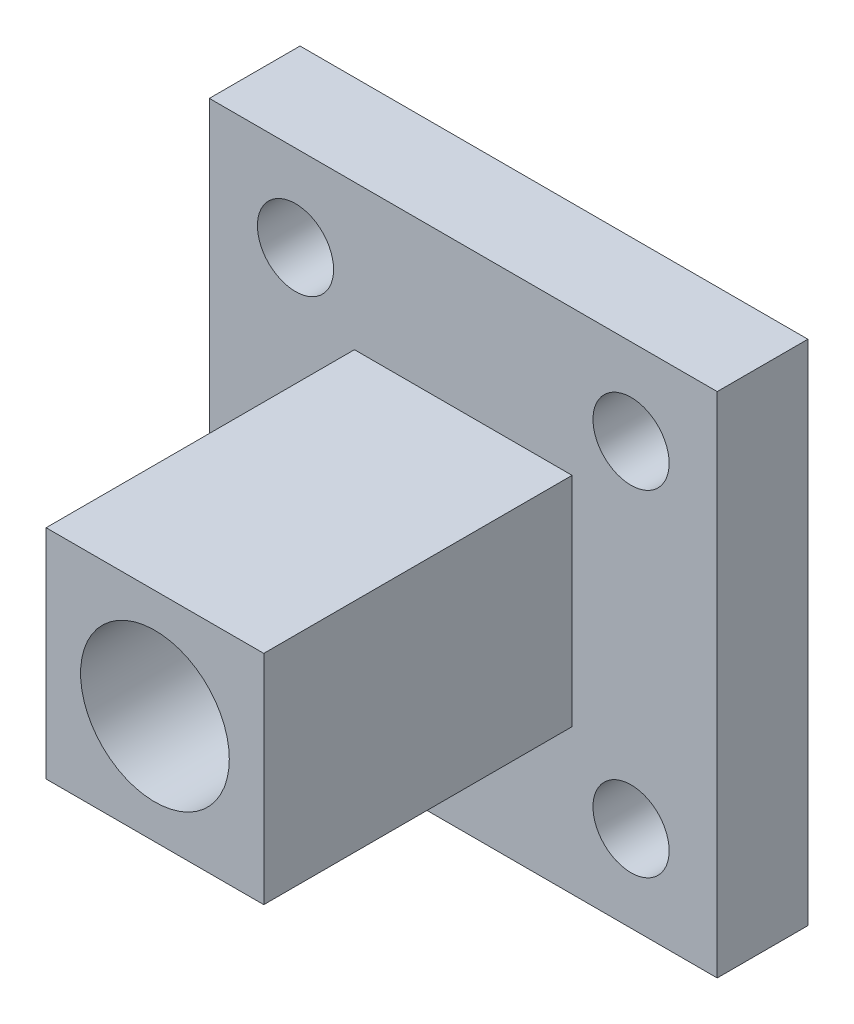
from build123d import *

# Parameters (mm, degrees)
SKETCH_1_W          = 28
SKETCH_1_H          = 28
SKETCH_1_R          = 2.1
EXTRUDE_1_DEPTH     = 5
SKETCH_5_W          = 12
SKETCH_5_H          = 12
EXTRUDE_3_DEPTH     = 17
SKETCH_10_R         = 4.1
CUT_EXTRUDE_7_DEPTH = 17


with BuildPart() as part:
    # 草图1 → 凸台-拉伸1 (new body)
    with BuildSketch(Plane.XY):
        with Locations((14, 14)):
            Rectangle(SKETCH_1_W, SKETCH_1_H)
        with Locations((4.75, 4.75)):
            Circle(SKETCH_1_R, mode=Mode.SUBTRACT)
        with Locations((23.25, 4.75)):
            Circle(SKETCH_1_R, mode=Mode.SUBTRACT)
        with Locations((4.75, 23.25)):
            Circle(SKETCH_1_R, mode=Mode.SUBTRACT)
        with Locations((23.25, 23.25)):
            Circle(SKETCH_1_R, mode=Mode.SUBTRACT)
    extrude(amount=EXTRUDE_1_DEPTH)

    # 草图5 → 凸台-拉伸3 (add)
    with BuildSketch(Plane.XY.offset(5)):
        with Locations((14, 14)):
            Rectangle(SKETCH_5_W, SKETCH_5_H)
    extrude(amount=EXTRUDE_3_DEPTH)

    # 草图10 → 切除-拉伸7 (cut)
    with BuildSketch(Plane.XY.offset(22)):
        with Locations((14, 14)):
            Circle(SKETCH_10_R)
    extrude(amount=-CUT_EXTRUDE_7_DEPTH, mode=Mode.SUBTRACT)


solid = part.part
